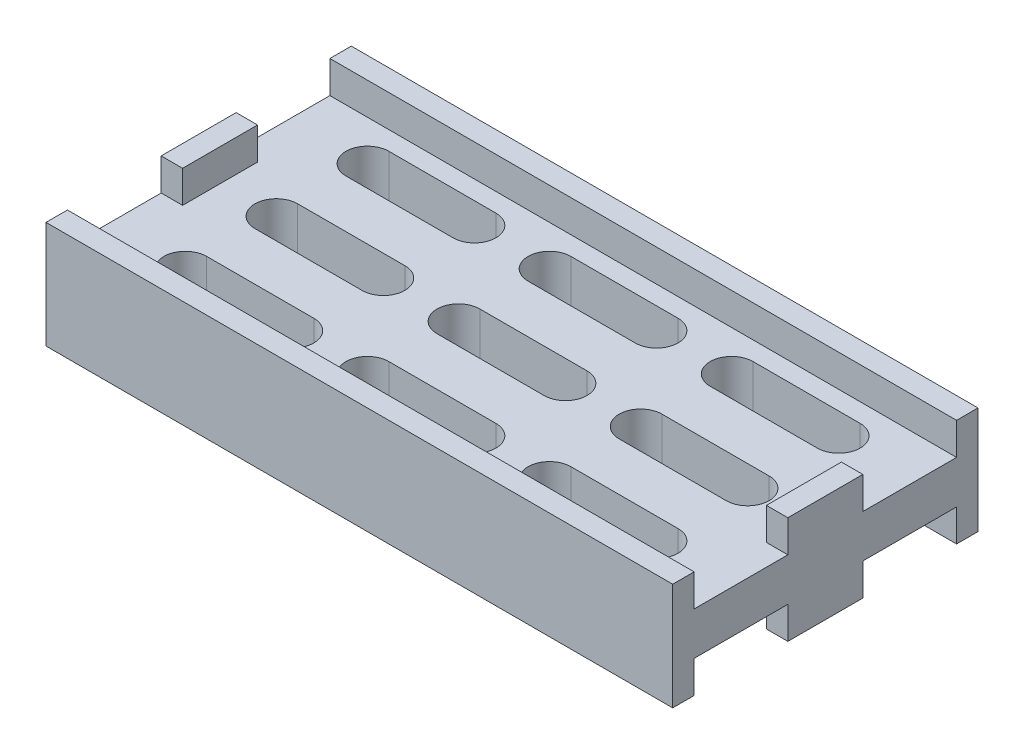
from build123d import *

# Parameters (mm, degrees)
SKETCH1_W           = 54.5
SKETCH1_H           = 24.5
BOSS_EXTRUDE1_DEPTH = 2
BOSS_EXTRUDE2_START = -2
SKETCH2_W           = 58.5
SKETCH2_H           = 28.5
SKETCH2_W_2         = 54.5
SKETCH2_H_2         = 24.5
BOSS_EXTRUDE2_DEPTH = 5
CUT_EXTRUDE1_DEPTH  = 33.918459867
FILL_PATTERN1_DEPTH = 2
LPATTERN1_COUNT     = 2
LPATTERN1_PITCH     = 8.5
LPATTERN1_COL_COUNT = 2
LPATTERN1_COL_PITCH = 8.5
SKETCH13_W          = 8.75
SKETCH13_H          = 3
CUT_EXTRUDE2_DEPTH  = 61.417816081


# Read off the part's stored shape, not the designer's step: Fill Pattern1
with BuildPart() as part:
    # Sketch1 → Boss-Extrude1 (new body)
    with BuildSketch(Plane(origin=(0, 0, 0), x_dir=(1, 0, 0), z_dir=(0, 1, 0))):
        Rectangle(SKETCH1_W, SKETCH1_H)
    extrude(amount=BOSS_EXTRUDE1_DEPTH)

    # Sketch2 → Boss-Extrude2 (add)
    with BuildSketch(Plane(origin=(0, 2, 0), x_dir=(1, 0, 0), z_dir=(0, 1, 0)).offset(BOSS_EXTRUDE2_START)):
        Rectangle(SKETCH2_W, SKETCH2_H)
        Rectangle(SKETCH2_W_2, SKETCH2_H_2, mode=Mode.SUBTRACT)
    extrude(amount=BOSS_EXTRUDE2_DEPTH)

    # Sketch5 → Cut-Extrude1 (cut, through all)
    with BuildSketch(Plane.XZ):
        with BuildLine():
            Line((-5, 2), (5, 2))
            ThreePointArc((5, 2), (7, 0), (5, -2))
            Line((5, -2), (-5, -2))
            ThreePointArc((-5, -2), (-7, 0), (-5, 2))
        make_face()
    cut_extrude1 = extrude(amount=-CUT_EXTRUDE1_DEPTH, mode=Mode.SUBTRACT)

    # Fill Pattern1 outline → Fill Pattern1 (cut)
    with BuildSketch(Plane(origin=(0, 0, 0), x_dir=(1, 0, 0), z_dir=(0, 1, 0))):
        with BuildLine():
            ThreePointArc((-22, 2), (-24, 0), (-22, -2))
            Line((-22, -2), (-12, -2))
            ThreePointArc((-12, -2), (-10, 0), (-12, 2))
            Line((-12, 2), (-22, 2))
        make_face()
        with BuildLine():
            ThreePointArc((12, 2), (10, 0), (12, -2))
            Line((12, -2), (22, -2))
            ThreePointArc((22, -2), (24, 0), (22, 2))
            Line((22, 2), (12, 2))
        make_face()
        with BuildLine():
            ThreePointArc((-22, 10.5), (-24, 8.5), (-22, 6.5))
            Line((-22, 6.5), (-12, 6.5))
            ThreePointArc((-12, 6.5), (-10, 8.5), (-12, 10.5))
            Line((-12, 10.5), (-22, 10.5))
        make_face()
        with BuildLine():
            ThreePointArc((12, 10.5), (10, 8.5), (12, 6.5))
            Line((12, 6.5), (22, 6.5))
            ThreePointArc((22, 6.5), (24, 8.5), (22, 10.5))
            Line((22, 10.5), (12, 10.5))
        make_face()
        with BuildLine():
            ThreePointArc((-22, -6.5), (-24, -8.5), (-22, -10.5))
            Line((-22, -10.5), (-12, -10.5))
            ThreePointArc((-12, -10.5), (-10, -8.5), (-12, -6.5))
            Line((-12, -6.5), (-22, -6.5))
        make_face()
        with BuildLine():
            ThreePointArc((12, -6.5), (10, -8.5), (12, -10.5))
            Line((12, -10.5), (22, -10.5))
            ThreePointArc((22, -10.5), (24, -8.5), (22, -6.5))
            Line((22, -6.5), (12, -6.5))
        make_face()
    extrude(amount=FILL_PATTERN1_DEPTH, mode=Mode.SUBTRACT)

    # LPattern1: Cut-Extrude1 ×2
    with Locations(*[(0, 0, i * LPATTERN1_PITCH) for i in range(1, LPATTERN1_COUNT)]):
        add(cut_extrude1, mode=Mode.SUBTRACT)

    # LPattern1 col: Cut-Extrude1 ×2
    with Locations(*[(0, 0, -i * LPATTERN1_COL_PITCH) for i in range(1, LPATTERN1_COL_COUNT)]):
        add(cut_extrude1, mode=Mode.SUBTRACT)

    # Sketch13 → Cut-Extrude2 (cut, through all)
    with BuildSketch(Plane(origin=(29.25, 0, 0), x_dir=(0, 0, -1), z_dir=(1, 0, 0))):
        with Locations((-7.875, 3.5)):
            Rectangle(SKETCH13_W, SKETCH13_H)
        with Locations((7.875, 3.5)):
            Rectangle(SKETCH13_W, SKETCH13_H)
    extrude(amount=-CUT_EXTRUDE2_DEPTH, mode=Mode.SUBTRACT)

    # Mirror1: part across plane


with BuildPart() as part_1:
    add(part.part)
    add(part.part.mirror(Plane(origin=(0, 0, 0), x_dir=(0, 0, 1), z_dir=(0, -1, 0))))


solid = part_1.part
